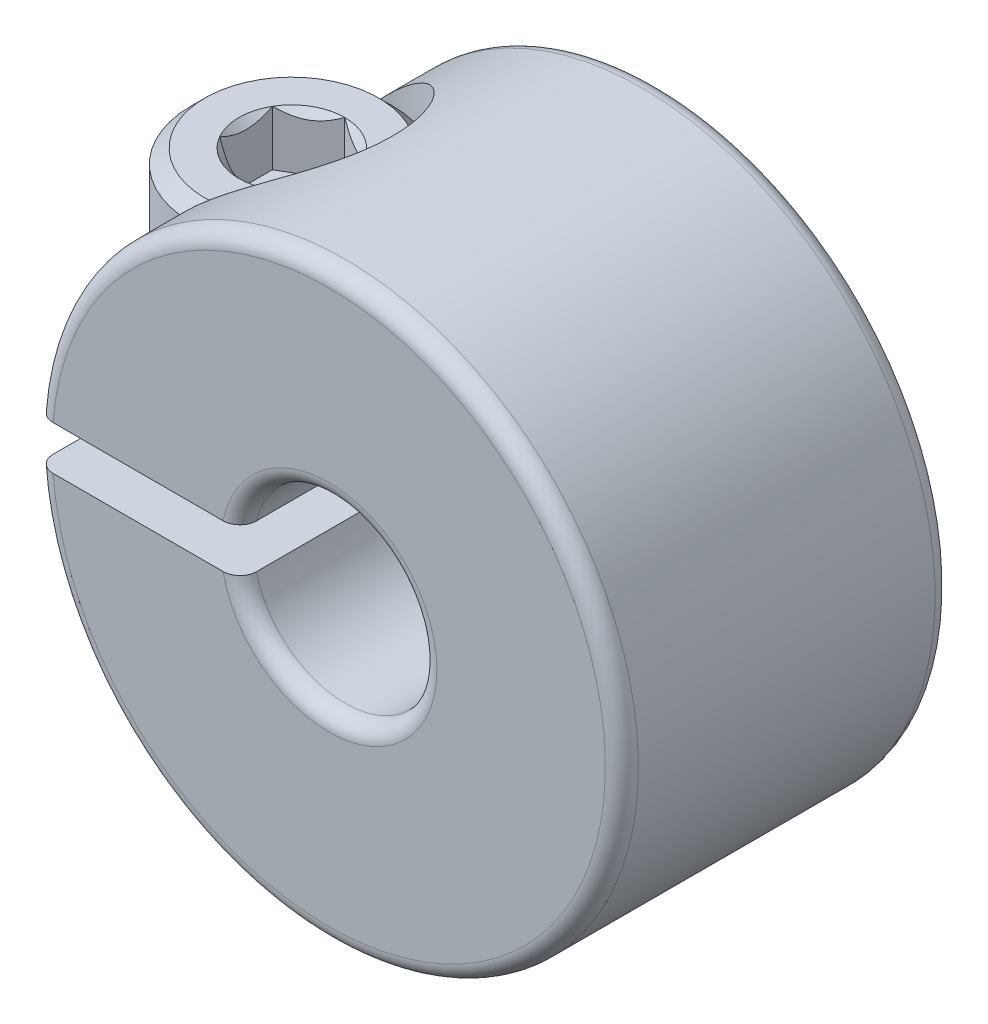
from build123d import *

# Parameters (mm, degrees)
EXTRUDE1_DEPTH     = 4.5
CUT_EXTRUDE2_DEPTH = 1.5
CHAMFER2_SIZE      = 0.381
FILLET1_R          = 0.45
CHAMFER3_SIZE      = 0.5
CUT_SWEEP2_PITCH   = 0.5


with BuildPart() as part:
    # Sketch1 → Extrude1 (new, symmetric)
    with BuildSketch(Plane.XY):
        with BuildLine():
            Line((-7.97746827, 0.6), (-2.42693222, 0.6))
            ThreePointArc((-2.42693222, 0.6), (2.5, 0), (-2.42693222, -0.6))
            Line((-2.42693222, -0.6), (-7.97746827, -0.6))
            ThreePointArc((-7.97746827, -0.6), (8, 0), (-7.97746827, 0.6))
        make_face()
    extrude(amount=EXTRUDE1_DEPTH, both=True)

    # Sketch25 → Cut-Revolve2 (revolve, cut)
    with BuildSketch(Plane(origin=(0, 0, 0), x_dir=(1, 0, 0), z_dir=(0, 1, 0))):
        Polygon((-5.583200245, 4.5), (-5.583200245, 4.754), (-4.821200245, 4.754), (-4.821200245, 4.5), (-5.202200245, 4.119), align=None)
    revolve(axis=Axis((0, 0, 0), (0.0025035177020324515, 0, 0.9999968661946474)), mode=Mode.SUBTRACT)

    # Sketch4 → Cut-Revolve1 (revolve, cut)
    with BuildSketch(Plane.XY, mode=Mode.PRIVATE) as cut_revolve1_sk:
        Polygon((-5.51, 8), (-2.76, 8), (-2.76, 2.85), (-4.01, 2.85), (-4.01, -8), (-5.51, -8), align=None)
    revolve(cut_revolve1_sk.sketch.rotate(Axis((-5.51, -8, 0), (0, 1, 0)), 90), axis=Axis((-5.51, -8, 0), (0, 1, 0)), mode=Mode.SUBTRACT)

    # Fillet1
    fillet1_edges = [part.edges().sort_by_distance(p)[0] for p in [
        (2.5, 0, 4.5),
        (8, 0, 4.5),
        (2.5, 0, -4.5),
        (8, 0, -4.5),
    ]]
    fillet(fillet1_edges, radius=FILLET1_R)


with BuildPart() as body_2:
    # Sketch6 → Revolve1 (revolve)
    with BuildSketch(Plane.XY, mode=Mode.PRIVATE) as revolve1_sk:
        Polygon((-5.51, 5.85), (-2.76, 5.85), (-2.76, 2.85), (-4.01, 2.85), (-4.01, -5.15), (-5.51, -5.15), align=None)
    revolve(revolve1_sk.sketch.rotate(Axis((-5.51, -5.15, 0), (0, 1, 0)), 90), axis=Axis((-5.51, -5.15, 0), (0, 1, 0)))

    # Sketch7 → Cut-Extrude2 (cut)
    with BuildSketch(Plane(origin=(0, 5.85, 0), x_dir=(-1, 0, 0), z_dir=(0, 1, 0))):
        Polygon((5.51, -1.443375673), (6.76, -0.721687836), (6.76, 0.721687836), (5.51, 1.443375673), (4.26, 0.721687836), (4.26, -0.721687836), align=None)
    extrude(amount=-CUT_EXTRUDE2_DEPTH, mode=Mode.SUBTRACT)

    # Cut-Extrude3 cone 1 section (through the dimple's axis) → Cut-Extrude3 (revolve, cut)
    with BuildSketch(Plane(origin=(-5.51, 5.85, 0), x_dir=(0, 0, 1), z_dir=(1, 0, 0))):
        Polygon((0, 0), (1.443375673, 0), (0, 1.443375673), align=None)
    revolve(axis=Axis((-5.51, 5.85, 0), (0, -1, 0)), mode=Mode.SUBTRACT)

    # Chamfer2
    chamfer2_edges = [body_2.edges().sort_by_distance(p)[0] for p in [
        (-5.51, 5.85, 2.75),
    ]]
    chamfer(chamfer2_edges, length=CHAMFER2_SIZE)

    # Chamfer3
    chamfer3_edges = [body_2.edges().sort_by_distance(p)[0] for p in [
        (-5.51, -5.15, 1.5),
    ]]
    chamfer(chamfer3_edges, length=CHAMFER3_SIZE)

    # Cut-Sweep2: arcs per turn and ends read off the stored shape
    # Cut-Sweep2: the profile of Sketch23 profile screwed along a right-hand helix through 17 turns, 6 arcs to a turn; built about Z, then put on its axis
    cut_sweep2_z = Axis((0, 0, 0), (0, 0, 1))
    cut_sweep2_corners = [(1.5003, 1.833e-06, -0.006771142), (1.5003, 1.833e-06, -0.444617552), (1.175240474, 1.436e-06, -0.256944347), (1.175240474, 1.436e-06, -0.194444347)]
    with BuildLine(mode=Mode.PRIVATE) as cut_sweep2_profile:
        Line(cut_sweep2_corners[0], cut_sweep2_corners[1])
        Line(cut_sweep2_corners[1], cut_sweep2_corners[2])
        Line(cut_sweep2_corners[2], cut_sweep2_corners[3])
        Line(cut_sweep2_corners[3], cut_sweep2_corners[0])
    cut_sweep2_cap = Face(cut_sweep2_profile.wire())
    cut_sweep2_turn_angles = [0, 30, 60, 90, 120, 150, 180, 210, 240, 270, 300, 330, 360]
    cut_sweep2_turn_weights = [1, 0.8660254037844387, 1, 0.8660254037844387, 1, 0.8660254037844387, 1, 0.8660254037844387, 1, 0.8660254037844387, 1, 0.8660254037844387, 1]
    cut_sweep2_turn_rails = [Edge.make_bspline([Vector(p[0], p[1], 0).rotate(cut_sweep2_z, cut_sweep2_turn_angles[k]) / cut_sweep2_turn_weights[k] + Vector(0, 0, p[2] + CUT_SWEEP2_PITCH * cut_sweep2_turn_angles[k] / 360) for k in range(13)], [0, 0, 0, 1, 1, 2, 2, 3, 3, 4, 4, 5, 5, 6, 6, 6], 2, cut_sweep2_turn_weights) for p in cut_sweep2_corners]
    cut_sweep2_turn_sides = [Face.make_surface_from_curves(cut_sweep2_turn_rails[p[0]], cut_sweep2_turn_rails[p[1]]) for p in [(0, 1), (1, 2), (2, 3), (3, 0)]]
    cut_sweep2 = Plane(origin=(-5.51, -5.15, 0), x_dir=(-0.9961946980917447, 0, -0.08715574274766849), z_dir=(0, 1, 0)) * Solid(Shell([*[p.moved(Location((0, 0, CUT_SWEEP2_PITCH * i))) for i in range(17) for p in cut_sweep2_turn_sides], cut_sweep2_cap, cut_sweep2_cap.rotate(cut_sweep2_z, 6120).moved(Location((0, 0, CUT_SWEEP2_PITCH * 6120 / 360)))]))
    add(cut_sweep2, mode=Mode.SUBTRACT)


solid = Compound([part.part, body_2.part])
